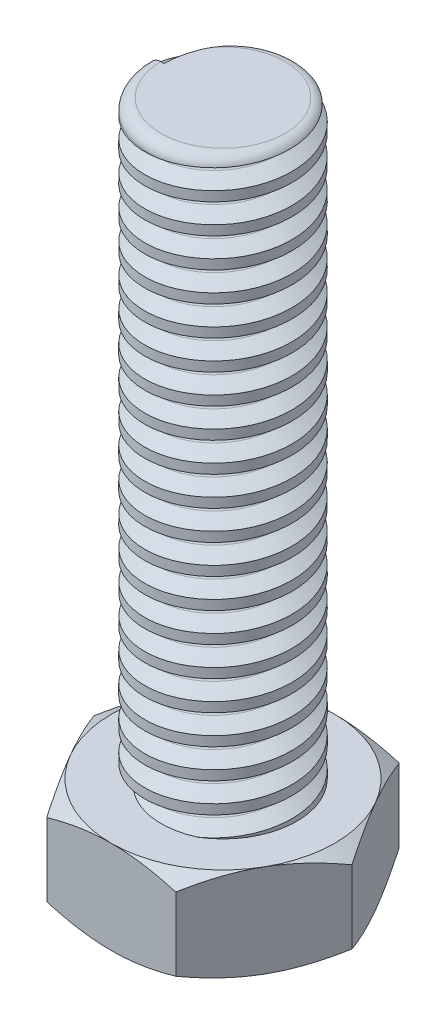
from build123d import *

# Parameters (mm, degrees)
RESSALTO_EXTRUS_O1_DEPTH  = 4
ESBO_O3_R                 = 3.175
RESSALTO_EXTRUS_O2_DEPTH  = 25.4
FILETE1_R                 = 0.5
VARREDURA_DE_CORTE3_PITCH = 1.27
VARREDURA_DE_CORTE3_TO    = 25.4
ESBO_O11_OUTSIDE_W        = 54.324
ESBO_O11_OUTSIDE_H        = 52.836
ESBO_O11_OUTSIDE_R        = 4.810771118
CORTE_EXTRUS_O1_DEPTH     = 10
CORTE_EXTRUS_O1_DRAFT     = -60
ESPELHAR1_COPY_1_SKETCH_W = 54.324
ESPELHAR1_COPY_1_SKETCH_H = 52.836
ESPELHAR1_COPY_1_SKETCH_R = 4.810771118
ESPELHAR1_COPY_1_DEPTH    = 10
ESPELHAR1_COPY_1_DRAFT    = -60


with BuildPart() as part:
    # Esboço2 → Ressalto-extrusão1 (new body)
    with BuildSketch(Plane(origin=(0, 0, 0), x_dir=(1, 0, 0), z_dir=(0, 1, 0))):
        Polygon((5.555, 0), (2.7775, 4.810771118), (-2.7775, 4.810771118), (-5.555, 0), (-2.7775, -4.810771118), (2.7775, -4.810771118), align=None)
    extrude(amount=RESSALTO_EXTRUS_O1_DEPTH)

    # Esboço3 → Ressalto-extrusão2 (add)
    with BuildSketch(Plane(origin=(0, 4, 0), x_dir=(1, 0, 0), z_dir=(0, 1, 0))):
        with Locations(Location((0, 0, 0), (0, 0, 270))):
            Circle(ESBO_O3_R)
    extrude(amount=RESSALTO_EXTRUS_O2_DEPTH)

    # Filete1
    filete1_edges = [part.edges().sort_by_distance(p)[0] for p in [
        (0, 29.4, -3.175),
    ]]
    fillet(filete1_edges, radius=FILETE1_R)

    # Varredura de corte3: arcs per turn and ends read off the stored shape
    # Varredura de corte3: the profile of Esboço10 screwed along a right-hand helix through 21 turns, 8 arcs to a turn; built about Z, then put on its axis
    varredura_de_corte3_z = Axis((0, 0, 0), (0, 0, 1))
    varredura_de_corte3_corners = [(2.585991655, 0, -0.08660254), (3.544504172, 0, -0.64), (3.544504172, 0, 0.64), (2.585991655, 0, 0.08660254), (2.535991655, 0, 0)]
    with BuildLine(mode=Mode.PRIVATE) as varredura_de_corte3_profile:
        Line(varredura_de_corte3_corners[0], varredura_de_corte3_corners[1])
        Line(varredura_de_corte3_corners[1], varredura_de_corte3_corners[2])
        Line(varredura_de_corte3_corners[2], varredura_de_corte3_corners[3])
        ThreePointArc((2.585991655, 0, 0.08660254), (2.549389115, 0, 0.05), (2.535991655, 0, 0))
        ThreePointArc((2.535991655, 0, 0), (2.549389115, 0, -0.05), (2.585991655, 0, -0.08660254))
    varredura_de_corte3_cap = Face(varredura_de_corte3_profile.wire())
    varredura_de_corte3_arcs = [((2.585991655, 0, 0.08660254), (2.535991655, 0, 0.057735027), (2.535991655, 0, 0), (1, 0.8660254037844347, 1)), ((2.535991655, 0, 0), (2.535991655, 0, -0.057735027), (2.585991655, 0, -0.08660254), (1, 0.8660254037844347, 1))]  # start, shoulder, end, weights
    varredura_de_corte3_turn_angles = [0, 22.5, 45, 67.5, 90, 112.5, 135, 157.5, 180, 202.5, 225, 247.5, 270, 292.5, 315, 337.5, 360]
    varredura_de_corte3_turn_weights = [1, 0.9238795325112867, 1, 0.9238795325112867, 1, 0.9238795325112867, 1, 0.9238795325112867, 1, 0.9238795325112867, 1, 0.9238795325112867, 1, 0.9238795325112867, 1, 0.9238795325112867, 1]
    varredura_de_corte3_turn_rails = [Edge.make_bspline([Vector(p[0], p[1], 0).rotate(varredura_de_corte3_z, varredura_de_corte3_turn_angles[k]) / varredura_de_corte3_turn_weights[k] + Vector(0, 0, p[2] + VARREDURA_DE_CORTE3_PITCH * varredura_de_corte3_turn_angles[k] / 360) for k in range(17)], [0, 0, 0, 1, 1, 2, 2, 3, 3, 4, 4, 5, 5, 6, 6, 7, 7, 8, 8, 8], 2, varredura_de_corte3_turn_weights) for p in varredura_de_corte3_corners]
    varredura_de_corte3_turn_sides = [*[Face.make_surface_from_curves(varredura_de_corte3_turn_rails[p[0]], varredura_de_corte3_turn_rails[p[1]]) for p in [(0, 1), (1, 2), (2, 3)]], *[Face.make_bezier_surface([[Vector(p[j][0], p[j][1], 0).rotate(varredura_de_corte3_z, varredura_de_corte3_turn_angles[2 * i + k]) / varredura_de_corte3_turn_weights[2 * i + k] + Vector(0, 0, p[j][2] + VARREDURA_DE_CORTE3_PITCH * varredura_de_corte3_turn_angles[2 * i + k] / 360) for k in range(3)] for j in range(3)], [[p[3][j] * varredura_de_corte3_turn_weights[2 * i + k] for k in range(3)] for j in range(3)]) for p in varredura_de_corte3_arcs for i in range(8)]]
    varredura_de_corte3_turn = Solid(Shell([*varredura_de_corte3_turn_sides, varredura_de_corte3_cap, varredura_de_corte3_cap.rotate(varredura_de_corte3_z, 360).moved(Location((0, 0, VARREDURA_DE_CORTE3_PITCH * 360 / 360)))]))
    varredura_de_corte3_each = [*[varredura_de_corte3_turn.moved(Location((0, 0, VARREDURA_DE_CORTE3_PITCH * i))) for i in range(21)]]
    add(Plane(origin=(0, 29.4, 0), x_dir=(-1, 0, 0), z_dir=(0, -1, 0)) * split(Compound([varredura_de_corte3_each[i] for i in range(0, 21, 2)]), bisect_by=Plane.XY.offset(VARREDURA_DE_CORTE3_TO), keep=Keep.BOTTOM, mode=Mode.PRIVATE), mode=Mode.SUBTRACT)
    add(Plane(origin=(0, 29.4, 0), x_dir=(-1, 0, 0), z_dir=(0, -1, 0)) * split(Compound([varredura_de_corte3_each[i] for i in range(1, 21, 2)]), bisect_by=Plane.XY.offset(VARREDURA_DE_CORTE3_TO), keep=Keep.BOTTOM, mode=Mode.PRIVATE), mode=Mode.SUBTRACT)


with BuildPart() as corte_extrus_o1_tool:
    # Esboço11 outside → Corte-extrusão1 (with draft: the straight prism first)
    with BuildSketch(Plane.XZ):
        Rectangle(ESBO_O11_OUTSIDE_W, ESBO_O11_OUTSIDE_H)
        Circle(ESBO_O11_OUTSIDE_R, mode=Mode.SUBTRACT)
    extrude(amount=-CORTE_EXTRUS_O1_DEPTH)
    # Corte-extrusão1: the draft: its side faces are tilted about the plane it starts from
    corte_extrus_o1_sides = [corte_extrus_o1_tool.faces().sort_by_distance(p)[0] for p in [
        (0, 5, -26.418),
        (27.162, 5, 0),
        (0, 5, 26.418),
        (-27.162, 5, 0),
        (-4.810771118, 5, 0),
    ]]
    draft(corte_extrus_o1_sides, Plane.XZ, CORTE_EXTRUS_O1_DRAFT)


with BuildPart() as part_1:
    add(part.part)

    # Corte-extrusão1: cut by corte_extrus_o1_tool
    add(corte_extrus_o1_tool.part, mode=Mode.SUBTRACT)


with BuildPart() as espelhar1_copy_1_tool:
    # Espelhar1 copy 1 sketch → Espelhar1 copy 1 (with draft: the straight prism first)
    with BuildSketch(Plane(origin=(0, 4, 0), x_dir=(1, 0, 0), z_dir=(0, 1, 0))):
        Rectangle(ESPELHAR1_COPY_1_SKETCH_W, ESPELHAR1_COPY_1_SKETCH_H)
        Circle(ESPELHAR1_COPY_1_SKETCH_R, mode=Mode.SUBTRACT)
    extrude(amount=-ESPELHAR1_COPY_1_DEPTH)
    # Espelhar1 copy 1: the draft: its side faces are tilted about the plane it starts from
    espelhar1_copy_1_sides = [espelhar1_copy_1_tool.faces().sort_by_distance(p)[0] for p in [
        (0, -1, -26.418),
        (27.162, -1, 0),
        (0, -1, 26.418),
        (-27.162, -1, 0),
        (-4.810771118, -1, 0),
    ]]
    draft(espelhar1_copy_1_sides, Plane(origin=(0, 4, 0), x_dir=(1, 0, 0), z_dir=(0, 1, 0)), ESPELHAR1_COPY_1_DRAFT)


with BuildPart() as part_2:
    add(part_1.part)

    # Espelhar1 copy 1: cut by espelhar1_copy_1_tool
    add(espelhar1_copy_1_tool.part, mode=Mode.SUBTRACT)


solid = part_2.part
